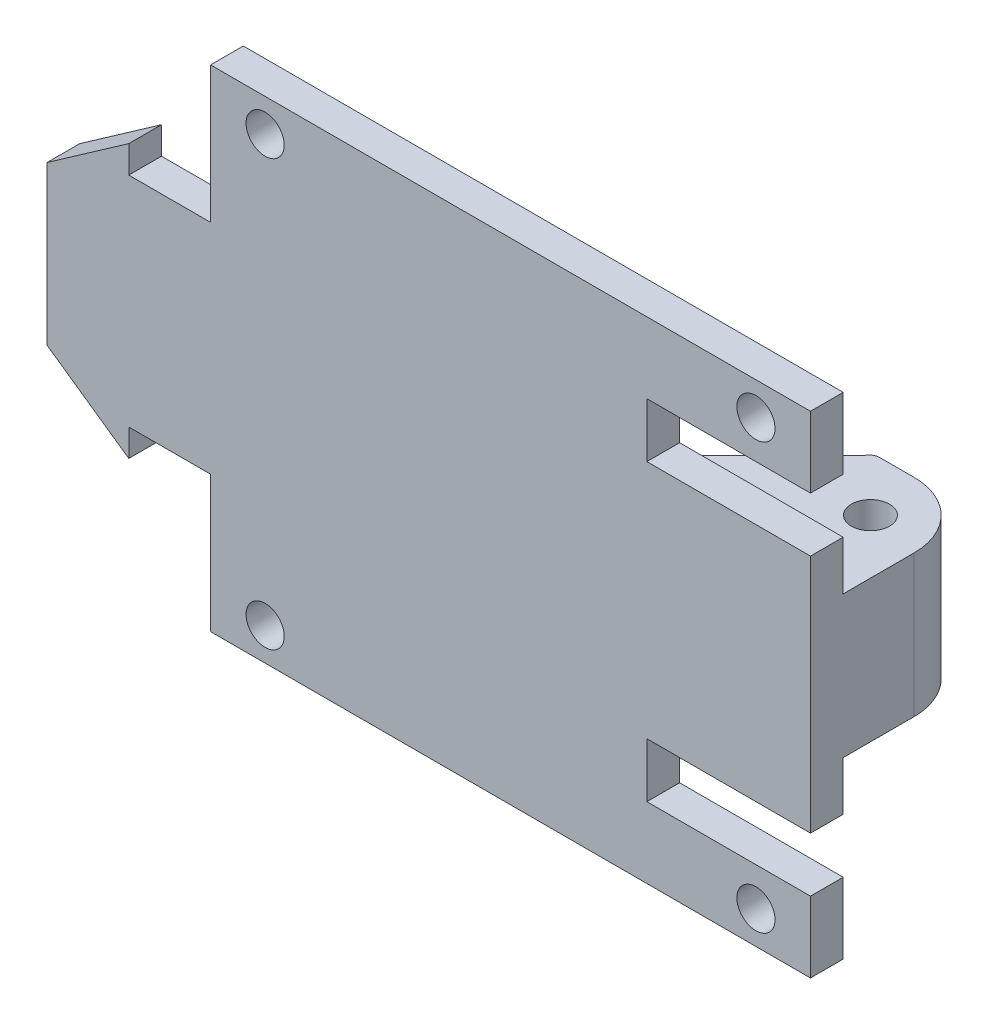
from build123d import *

# Parameters (mm, degrees)
SKETCH1_W           = 55
SKETCH1_H           = 45
BOSS_EXTRUDE1_DEPTH = 3
SKETCH2_W           = 10
SKETCH2_H           = 13
BOSS_EXTRUDE2_DEPTH = 12.5
SKETCH3_R           = 1.75
CUT_EXTRUDE1_DEPTH  = 13.5
FILLET1_R           = 6
CHAMFER1_SIZE       = 12
FILLET3_R           = 1
SKETCH4_W           = 20
SKETCH4_H           = 5
CUT_EXTRUDE3_DEPTH  = 5
SKETCH7_R           = 1.75
CUT_EXTRUDE4_DEPTH  = 5
BOSS_EXTRUDE4_DEPTH = 3


with BuildPart() as part:
    # Sketch1 → Boss-Extrude1 (new body)
    with BuildSketch(Plane.XY):
        with Locations((-16.936997319, -3.156836461)):
            Rectangle(SKETCH1_W, SKETCH1_H)
    extrude(amount=BOSS_EXTRUDE1_DEPTH)

    # Sketch2 → Boss-Extrude2 (add)
    with BuildSketch(Plane(origin=(0, 0, 0), x_dir=(-1, 0, 0), z_dir=(0, 0, -1))):
        with Locations((-5.563002681, -3.156836461)):
            Rectangle(SKETCH2_W, SKETCH2_H)
    extrude(amount=BOSS_EXTRUDE2_DEPTH)

    # Sketch3 → Cut-Extrude1 (cut)
    with BuildSketch(Plane(origin=(0, 3.343163539, 0), x_dir=(1, 0, 0), z_dir=(0, 1, 0))):
        with Locations(Location((5.563002681, 7.5, 0), (0, 0, 180))):
            Circle(SKETCH3_R)
    extrude(amount=-CUT_EXTRUDE1_DEPTH, mode=Mode.SUBTRACT)

    # Fillet1
    fillet1_edges = [part.edges().sort_by_distance(p)[0] for p in [
        (10.563002681, -3.156836461, -12.5),
    ]]
    fillet(fillet1_edges, radius=FILLET1_R)

    # Chamfer1
    chamfer1_edges = [part.edges().sort_by_distance(p)[0] for p in [
        (0.563002681, -3.156836461, 0),
    ]]
    chamfer(chamfer1_edges, length=CHAMFER1_SIZE)

    # Fillet3
    # the kernel refuses this fillet: 1 mm, written as the material it takes off along each edge
    with BuildSketch(Plane(origin=(0.563002681, 5.508227048, -12.5), x_dir=(1, 0, 0), z_dir=(0, -1, 0))) as fillet3_piece_1:
        with BuildLine():
            CenterArc((0.866025404, 1), FILLET3_R, 210, 60)
            Line((0, 0.5), (-0.017320508, 0.49))
            ThreePointArc((-0.017320508, 0.49), (-0.02, 0.25), (-0.02, 0))
            Line((-0.02, 0), (0, -0.02))
            Line((0, -0.02), (0.866025404, -0.02))
            Line((0.866025404, -0.02), (0.866025404, 0))
        make_face()
    extrude(amount=17.330127019, mode=Mode.SUBTRACT)

    # Sketch4 → Cut-Extrude3 (cut)
    with BuildSketch(Plane(origin=(0, 0, 0), x_dir=(-1, 0, 0), z_dir=(0, 0, -1))):
        with Locations((-5.563002681, 10.343163539)):
            Rectangle(SKETCH4_W, SKETCH4_H)
    cut_extrude3 = extrude(amount=-CUT_EXTRUDE3_DEPTH, mode=Mode.SUBTRACT)

    # Mirror2: Cut-Extrude3 across plane
    add(cut_extrude3.mirror(Plane.ZX.offset(-3.156836461)), mode=Mode.SUBTRACT)

    # Sketch7 → Cut-Extrude4 (cut)
    with BuildSketch(Plane(origin=(0, 0, 0), x_dir=(-1, 0, 0), z_dir=(0, 0, -1))):
        with Locations((-5.563002681, 16.343163539)):
            Circle(SKETCH7_R)
        with Locations((39.436997319, 16.343163539)):
            Circle(SKETCH7_R)
        with Locations(Location((39.436997319, -22.656836461, 0), (0, 0, 180))):
            Circle(SKETCH7_R)
        with Locations(Location((-5.563002681, -22.656836461, 0), (0, 0, 180))):
            Circle(SKETCH7_R)
    extrude(amount=-CUT_EXTRUDE4_DEPTH, mode=Mode.SUBTRACT)

    # Sketch8 → Boss-Extrude4 (add)
    with BuildSketch(Plane(origin=(0, 0, 0), x_dir=(-1, 0, 0), z_dir=(0, 0, -1))):
        Polygon((44.436997319, 6.843163539), (51.936997319, 6.843163539), (51.936997319, 9.343163539), (59.436997319, 4.091607002), (59.436997319, -10.405279925), (51.936997319, -15.656836461), (51.936997319, -13.156836461), (44.436997319, -13.156836461), align=None)
    extrude(amount=-BOSS_EXTRUDE4_DEPTH)


solid = part.part
